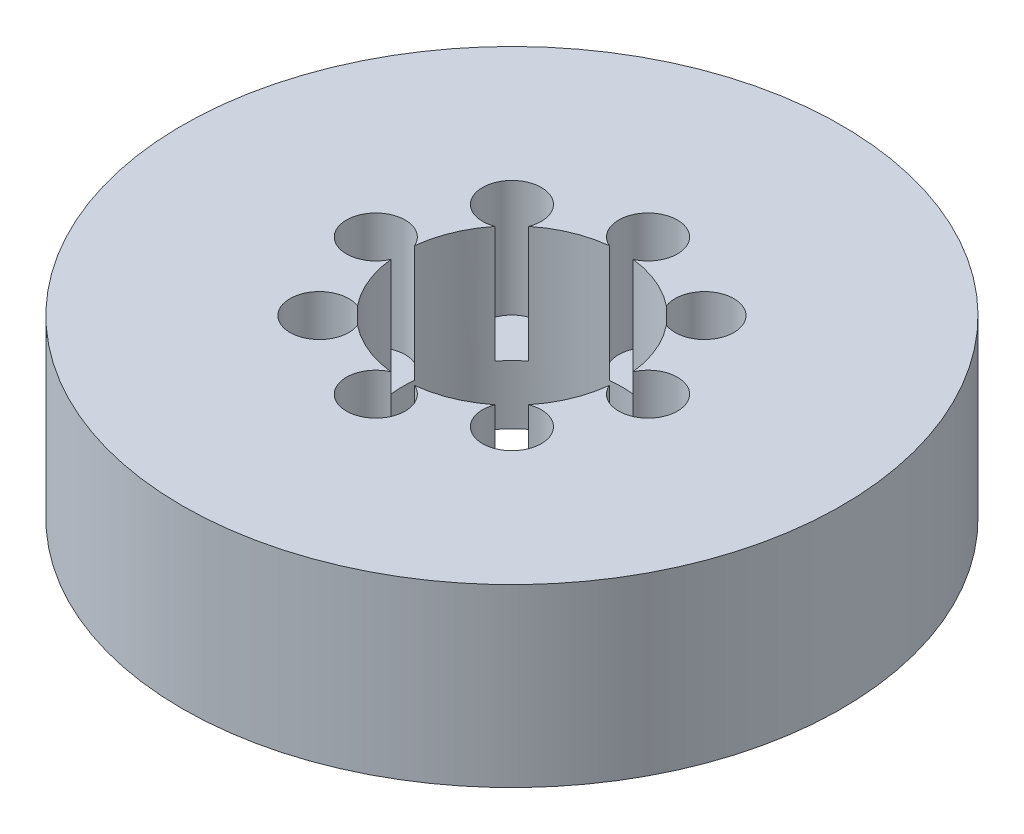
from build123d import *

# Parameters (mm, degrees)
SKETCH1_R           = 52.5
BOSS_EXTRUDE1_DEPTH = 28
SKETCH2_R           = 17.5
CUT_EXTRUDE1_DEPTH  = 80.350488341
SKETCH3_R           = 4.685038561
CUT_EXTRUDE2_DEPTH  = 18.579123124
CIRPATTERN1_COUNT   = 8


with BuildPart() as part:
    # Sketch1 → Boss-Extrude1 (new body)
    with BuildSketch(Plane(origin=(0, 0, 0), x_dir=(1, 0, 0), z_dir=(0, 1, 0))):
        Circle(SKETCH1_R)
    extrude(amount=BOSS_EXTRUDE1_DEPTH)

    # Sketch2 → Cut-Extrude1 (cut, through all)
    with BuildSketch(Plane(origin=(0, 0, 0), x_dir=(1, 0, 0), z_dir=(0, 1, 0))):
        Circle(SKETCH2_R)
    extrude(amount=CUT_EXTRUDE1_DEPTH, mode=Mode.SUBTRACT)

    # Sketch3 → Cut-Extrude2 (cut)
    with BuildSketch(Plane(origin=(0, 28, 0), x_dir=(1, 0, 0), z_dir=(0, 1, 0))):
        with Locations((-21.684539548, 0)):
            Circle(SKETCH3_R)
    cut_extrude2 = extrude(amount=-CUT_EXTRUDE2_DEPTH, mode=Mode.SUBTRACT)

    # CirPattern1: Cut-Extrude2 ×8 about axis
    cirpattern1_axis = Axis((0, 0, 0), (0, 1, 0))
    for i in range(1, CIRPATTERN1_COUNT):
        add(cut_extrude2.rotate(cirpattern1_axis, i * 360 / CIRPATTERN1_COUNT), mode=Mode.SUBTRACT)


solid = part.part
